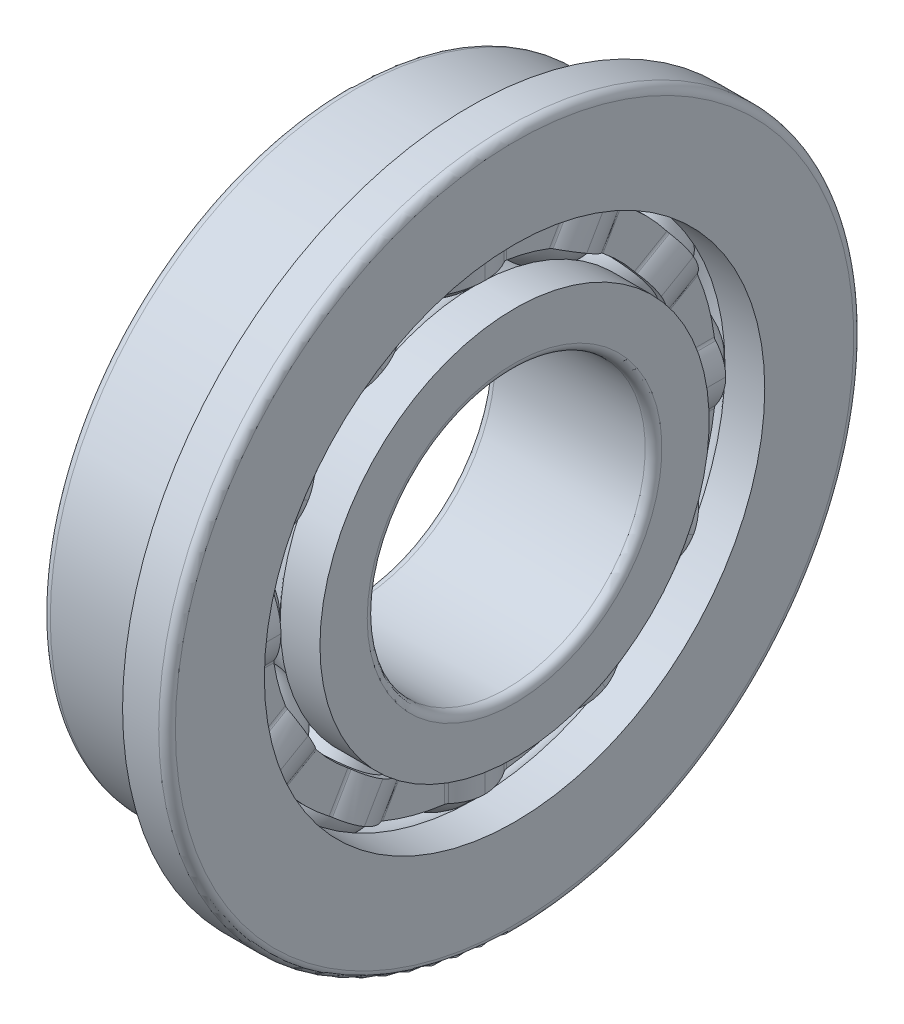
from build123d import *

# Parameters (mm, degrees)
SKETCH10_W                = 1.92881306
SKETCH10_H                = 0.666666666
PATTERN_BALL_COUNT        = 12
COSMETIC_FILLET_OUTER_1_R = 0.15
COSMETIC_FILLET_OUTER_2_R = 0.15
COSMETIC_FILLET_INNER_1_R = 0.15
COSMETIC_FILLET_INNER_2_R = 0.15


with BuildPart() as part:
    # Sketch7 → Body-Ball (revolve)
    with BuildSketch(Plane.XY):
        with BuildLine():
            Line((-0.9, 4), (0.9, 4))
            ThreePointArc((0.9, 4), (0, 3.1), (-0.9, 4))
        make_face()
    body_ball = revolve(axis=Axis((-0.9, 4, 0), (1, 0, 0)))

    # Sketch10 → Body-Ball-Cage (revolve)
    with BuildSketch(Plane.XY, mode=Mode.PRIVATE) as body_ball_cage_sk:
        with Locations((0, 4)):
            Rectangle(SKETCH10_W, SKETCH10_H)
    revolve(body_ball_cage_sk.sketch.rotate(Axis((-1.5, 0, 0), (1, 0, 0)), 90), axis=Axis((-1.5, 0, 0), (1, 0, 0)))

    # Sketch16 for Cut-Ball-Cag → Cut-Ball-Cage-1 section 0
    with BuildSketch(Plane(origin=(0, 2.832247266, 0.758898368), x_dir=(-1, 0, 0), z_dir=(-3.4914813388431334e-15, 0.9659258262890681, 0.25881904510252157))):
        with BuildLine():
            Line((0.795503053, -0.208993894), (0.795503053, 0.208993894))
            # circular arc as an exact rational Bezier (weights 1, cos(half-angle), 1)
            Bezier((0.795503053, 0.208993894), (0.795503053, 0.239600184), (0.812015206, 0.265370201), weights=[1, 0.959683372, 1])
            Bezier((0.812015206, 0.265370201), (0.96440653, 0.503202724), (0.96440653, 0.785669403), weights=[1, 0.959683372, 1])
            Line((0.96440653, 0.785669403), (0.96440653, -0.785669403))
            Bezier((0.96440653, -0.785669403), (0.96440653, -0.503202724), (0.812015206, -0.265370201), weights=[1, 0.959683372, 1])
            Bezier((0.812015206, -0.265370201), (0.795503053, -0.239600184), (0.795503053, -0.208993894), weights=[1, 0.959683372, 1])
        make_face()
    # Sketch17 for Cut-Ball-Cag → Cut-Ball-Cage-1 section 1
    with BuildSketch(Plane(origin=(0, 4.631854349, 1.241101632), x_dir=(1, 0, 0), z_dir=(-3.4914813388431337e-15, -0.9659258262890682, -0.2588190451025214))):
        with BuildLine():
            Line((-0.795503053, -0.708207449), (-0.795503053, 0.708207449))
            Bezier((-0.795503053, 0.708207449), (-0.795503053, 0.738813738), (-0.812015206, 0.764583755), weights=[1, 0.959683372, 1])
            Bezier((-0.812015206, 0.764583755), (-0.96440653, 1.002416279), (-0.96440653, 1.284882957), weights=[1, 0.959683372, 1])
            Line((-0.96440653, 1.284882957), (-0.96440653, -1.284882957))
            Bezier((-0.96440653, -1.284882957), (-0.96440653, -1.002416279), (-0.812015206, -0.764583755), weights=[1, 0.959683372, 1])
            Bezier((-0.812015206, -0.764583755), (-0.795503053, -0.738813738), (-0.795503053, -0.708207449), weights=[1, 0.959683372, 1])
        make_face()
    cut_ball_cage_1 = loft(mode=Mode.SUBTRACT)

    # Sketch15 for Cut-Ball-Cag → Cut-Ball-Cage-2 section 0
    with BuildSketch(Plane(origin=(0, 4.631854349, 1.241101632), x_dir=(1, 0, 0), z_dir=(-3.4914813388431337e-15, -0.9659258262890682, -0.2588190451025214))):
        with BuildLine():
            Line((0.795503053, -0.708207449), (0.795503053, 0.708207449))
            Bezier((0.795503053, 0.708207449), (0.795503053, 0.738813738), (0.812015206, 0.764583755), weights=[1, 0.959683372, 1])
            Bezier((0.812015206, 0.764583755), (0.96440653, 1.002416279), (0.96440653, 1.284882957), weights=[1, 0.959683372, 1])
            Line((0.96440653, 1.284882957), (0.96440653, -1.284882957))
            Bezier((0.96440653, -1.284882957), (0.96440653, -1.002416279), (0.812015206, -0.764583755), weights=[1, 0.959683372, 1])
            Bezier((0.812015206, -0.764583755), (0.795503053, -0.738813738), (0.795503053, -0.708207449), weights=[1, 0.959683372, 1])
        make_face()
    # Sketch14 for Cut-Ball-Cag → Cut-Ball-Cage-2 section 1
    with BuildSketch(Plane(origin=(0, 2.832247266, 0.758898368), x_dir=(-1, 0, 0), z_dir=(-3.4914813388431334e-15, 0.9659258262890681, 0.25881904510252157))):
        with BuildLine():
            Line((-0.795503053, -0.208993894), (-0.795503053, 0.208993894))
            Bezier((-0.795503053, 0.208993894), (-0.795503053, 0.239600184), (-0.812015206, 0.265370201), weights=[1, 0.959683372, 1])
            Bezier((-0.812015206, 0.265370201), (-0.96440653, 0.503202724), (-0.96440653, 0.785669403), weights=[1, 0.959683372, 1])
            Line((-0.96440653, 0.785669403), (-0.96440653, -0.785669403))
            Bezier((-0.96440653, -0.785669403), (-0.96440653, -0.503202724), (-0.812015206, -0.265370201), weights=[1, 0.959683372, 1])
            Bezier((-0.812015206, -0.265370201), (-0.795503053, -0.239600184), (-0.795503053, -0.208993894), weights=[1, 0.959683372, 1])
        make_face()
    cut_ball_cage_2 = loft(mode=Mode.SUBTRACT)

    # Pattern-Ball: Body-Ball, Cut-Ball-Cage-1, Cut-Ball-Cage-2 ×12 about axis
    pattern_ball_axis = Axis((-1.1, 0, 0), (1, 0, 0))
    add([body_ball.rotate(pattern_ball_axis, i * 360 / PATTERN_BALL_COUNT) for i in range(1, PATTERN_BALL_COUNT)])
    add([cut_ball_cage_1.rotate(pattern_ball_axis, i * 360 / PATTERN_BALL_COUNT) for i in range(1, PATTERN_BALL_COUNT)], mode=Mode.SUBTRACT)
    add([cut_ball_cage_2.rotate(pattern_ball_axis, i * 360 / PATTERN_BALL_COUNT) for i in range(1, PATTERN_BALL_COUNT)], mode=Mode.SUBTRACT)

    # Sketch2 → Body-Inner (revolve)
    with BuildSketch(Plane.XY, mode=Mode.PRIVATE) as body_inner_sk:
        with BuildLine():
            Line((-1.5, 3.5), (-1.5, 2.5))
            Line((-1.5, 2.5), (1.5, 2.5))
            Line((1.5, 2.5), (1.5, 3.5))
            Line((1.5, 3.5), (0.785062461, 3.5))
            ThreePointArc((0.785062461, 3.5), (0, 3.136730983), (-0.785062461, 3.5))
            Line((-0.785062461, 3.5), (-1.5, 3.5))
        make_face()
    revolve(body_inner_sk.sketch.rotate(Axis((-1.5, 0, 0), (1, 0, 0)), 90), axis=Axis((-1.5, 0, 0), (1, 0, 0)))

    # Sketch8 → Body-Outer (revolve)
    with BuildSketch(Plane.XY, mode=Mode.PRIVATE) as body_outer_sk:
        with BuildLine():
            Line((0.7, 6.25), (0.7, 5.5))
            Line((0.7, 5.5), (-1.5, 5.5))
            Line((-1.5, 5.5), (-1.5, 4.5))
            Line((-1.5, 4.5), (-0.785062461, 4.5))
            ThreePointArc((-0.785062461, 4.5), (0, 4.863269017), (0.785062461, 4.5))
            Line((0.785062461, 4.5), (1.5, 4.5))
            Line((1.5, 4.5), (1.5, 6.25))
            Line((1.5, 6.25), (0.7, 6.25))
        make_face()
    revolve(body_outer_sk.sketch.rotate(Axis((-1.5, 0, 0), (1, 0, 0)), 90), axis=Axis((-1.5, 0, 0), (1, 0, 0)))

    # Cosmetic-Fillet-Outer-1
    cosmetic_fillet_outer_1_edges = [part.edges().sort_by_distance(p)[0] for p in [
        (-1.5, 0, -5.5),
    ]]
    fillet(cosmetic_fillet_outer_1_edges, radius=COSMETIC_FILLET_OUTER_1_R)

    # Cosmetic-Fillet-Outer-2
    cosmetic_fillet_outer_2_edges = [part.edges().sort_by_distance(p)[0] for p in [
        (1.5, 0, -6.25),
    ]]
    fillet(cosmetic_fillet_outer_2_edges, radius=COSMETIC_FILLET_OUTER_2_R)

    # Cosmetic-Fillet-Inner-1
    cosmetic_fillet_inner_1_edges = [part.edges().sort_by_distance(p)[0] for p in [
        (-1.5, 0, -2.5),
    ]]
    fillet(cosmetic_fillet_inner_1_edges, radius=COSMETIC_FILLET_INNER_1_R)

    # Cosmetic-Fillet-Inner-2
    cosmetic_fillet_inner_2_edges = [part.edges().sort_by_distance(p)[0] for p in [
        (1.5, 0, -2.5),
    ]]
    fillet(cosmetic_fillet_inner_2_edges, radius=COSMETIC_FILLET_INNER_2_R)


solid = part.part
